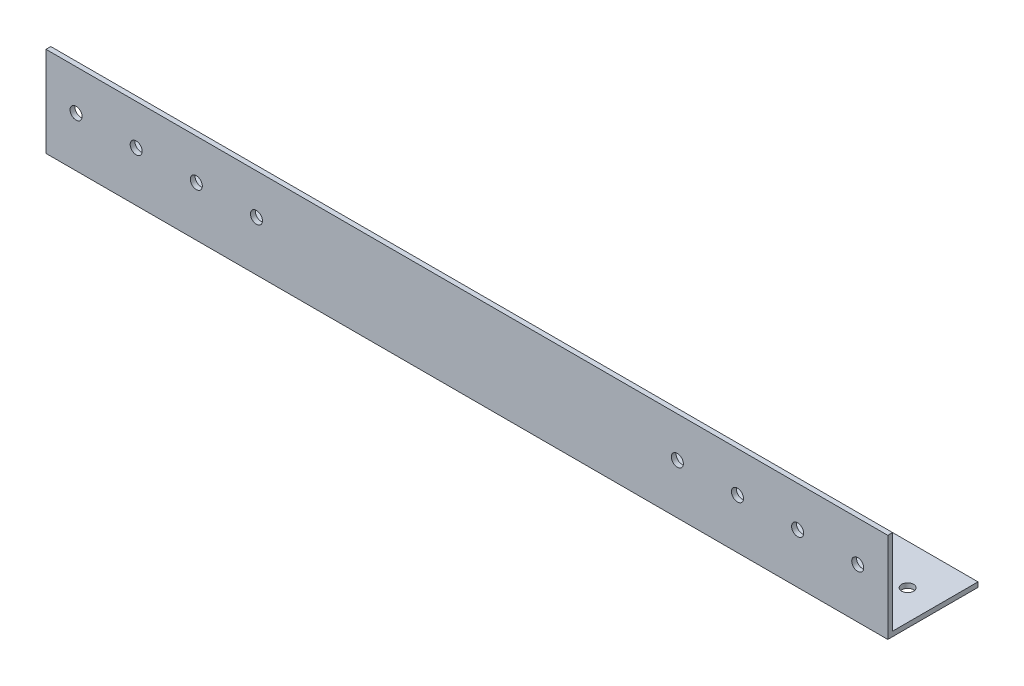
from build123d import *

# Parameters (mm, degrees)
EXTRUDE_1_DEPTH     = 700
SKETCH_2_R          = 5
CUT_EXTRUDE_1_DEPTH = 10
SKETCH_3_R          = 5
CUT_EXTRUDE_2_DEPTH = 10


with BuildPart() as part:
    # Эскиз1 → Вытянуть-Тонкостенный1 (new body)
    with BuildSketch(Plane(origin=(0, 0, 0), x_dir=(0, 0, -1), z_dir=(1, 0, 0))):
        Polygon((75, 0), (0, 0), (0, 75), (4, 75), (4, 4), (75, 4), align=None)
    extrude(amount=EXTRUDE_1_DEPTH)

    # Эскиз2 → Вырез-Вытянуть1 (cut)
    with BuildSketch(Plane.XY):
        with Locations((25, 41.5)):
            Circle(SKETCH_2_R)
        with Locations((75, 41.5)):
            Circle(SKETCH_2_R)
        with Locations((125, 41.5)):
            Circle(SKETCH_2_R)
        with Locations((175, 41.5)):
            Circle(SKETCH_2_R)
        with Locations((525, 41.5)):
            Circle(SKETCH_2_R)
        with Locations((575, 41.5)):
            Circle(SKETCH_2_R)
        with Locations((625, 41.5)):
            Circle(SKETCH_2_R)
        with Locations((675, 41.5)):
            Circle(SKETCH_2_R)
    extrude(amount=-CUT_EXTRUDE_1_DEPTH, mode=Mode.SUBTRACT)

    # Эскиз3 → Вырез-Вытянуть2 (cut)
    with BuildSketch(Plane.XZ):
        with Locations((25, -41.5)):
            Circle(SKETCH_3_R)
        with Locations((75, -41.5)):
            Circle(SKETCH_3_R)
        with Locations((125, -41.5)):
            Circle(SKETCH_3_R)
        with Locations((175, -41.5)):
            Circle(SKETCH_3_R)
        with Locations((525, -41.5)):
            Circle(SKETCH_3_R)
        with Locations((575, -41.5)):
            Circle(SKETCH_3_R)
        with Locations((625, -41.5)):
            Circle(SKETCH_3_R)
        with Locations((675, -41.5)):
            Circle(SKETCH_3_R)
    extrude(amount=-CUT_EXTRUDE_2_DEPTH, mode=Mode.SUBTRACT)


solid = part.part
